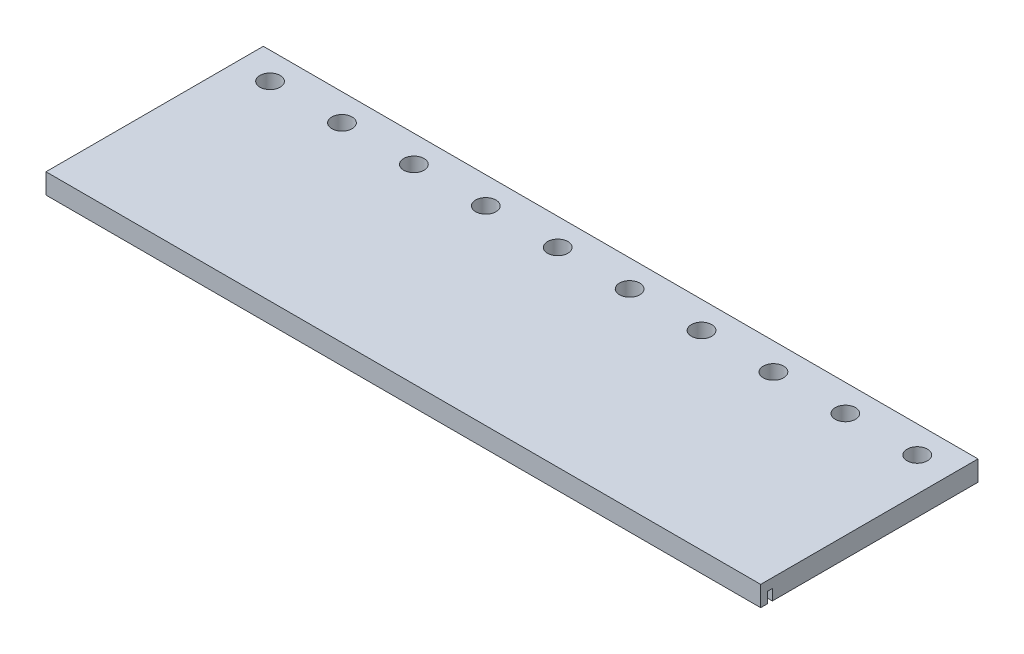
from build123d import *

# Parameters (mm, degrees)
SKETCH1_W               = 673.1
SKETCH1_H               = 204.6732
BOSS_EXTRUDE1_DEPTH     = 9.525
CUT_EXTRUDE1_DEPTH      = 353.280548284
CUT_EXTRUDE1_DEPTH_BACK = 353.280548284
SKETCH2_R               = 9.584587104
SKETCH4_W               = 673.1
SKETCH4_H               = 4.699
CUT_EXTRUDE2_DEPTH      = 10.16
CUT_EXTRUDE5_DEPTH      = 7.9375


with BuildPart() as part:
    # Sketch1 → Boss-Extrude1 (new, symmetric)
    with BuildSketch(Plane(origin=(0, 0, 0), x_dir=(1, 0, 0), z_dir=(0, 1, 0))):
        Rectangle(SKETCH1_W, SKETCH1_H)
    extrude(amount=BOSS_EXTRUDE1_DEPTH, both=True)

    # Sketch2 → Cut-Extrude1 (cut, two sides: drawn at the far end of the back side and taken through both)
    with BuildSketch(Plane(origin=(0, 9.525, 0), x_dir=(1, 0, 0), z_dir=(0, 1, 0)).offset(-CUT_EXTRUDE1_DEPTH_BACK)):
        with Locations((-304.8, 76.930371018)):
            Circle(SKETCH2_R)
        with Locations((-237.0709, 76.930371018)):
            Circle(SKETCH2_R)
        with Locations((-169.3418, 76.930371018)):
            Circle(SKETCH2_R)
        with Locations((-101.6127, 76.930371018)):
            Circle(SKETCH2_R)
        with Locations((-33.8836, 76.930371018)):
            Circle(SKETCH2_R)
        with Locations((33.8455, 76.930371018)):
            Circle(SKETCH2_R)
        with Locations((101.5746, 76.930371018)):
            Circle(SKETCH2_R)
        with Locations((169.3037, 76.930371018)):
            Circle(SKETCH2_R)
        with Locations((237.0328, 76.930371018)):
            Circle(SKETCH2_R)
        with Locations((304.7619, 76.930371018)):
            Circle(SKETCH2_R)
    extrude(amount=CUT_EXTRUDE1_DEPTH + CUT_EXTRUDE1_DEPTH_BACK, mode=Mode.SUBTRACT)

    # Sketch4 → Cut-Extrude2 (cut)
    with BuildSketch(Plane.XZ.offset(9.525)):
        with Locations((0, 93.6860458)):
            Rectangle(SKETCH4_W, SKETCH4_H)
    extrude(amount=-CUT_EXTRUDE2_DEPTH, mode=Mode.SUBTRACT)

    # Sketch7 → Cut-Extrude5 (cut)
    with BuildSketch(Plane.XZ.offset(9.525)):
        with BuildLine():
            Line((-323.05625, -26.291096465), (323.05625, -26.291096465))
            ThreePointArc((323.05625, -26.291096465), (331.05725, -34.292096465), (323.05625, -42.293096465))
            Line((323.05625, -42.293096465), (-323.05625, -42.293096465))
            ThreePointArc((-323.05625, -42.293096465), (-331.05725, -34.292096465), (-323.05625, -26.291096465))
        make_face()
    extrude(amount=-CUT_EXTRUDE5_DEPTH, mode=Mode.SUBTRACT)


solid = part.part
